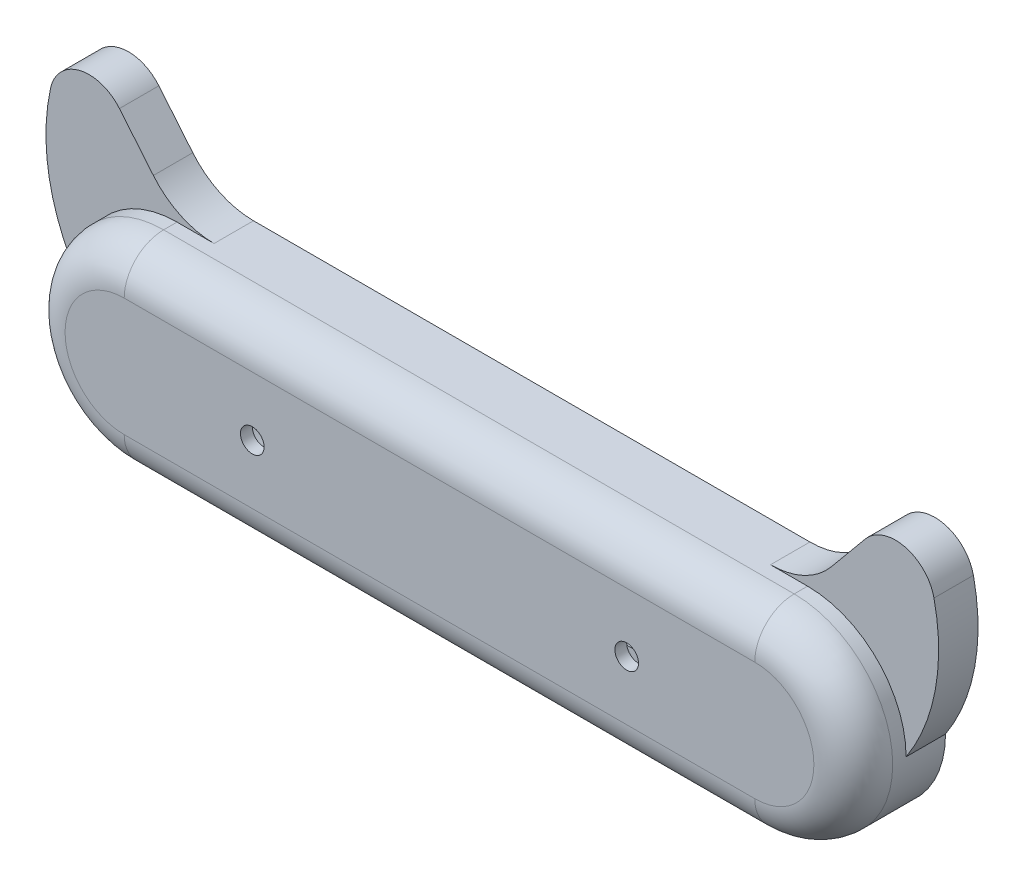
from build123d import *

# Parameters (mm, degrees)
SKETCH1_R           = 2
BOSS_EXTRUDE1_DEPTH = 4
BOSS_EXTRUDE2_DEPTH = 16.4
SKETCH3_R           = 3
BOSS_EXTRUDE3_DEPTH = 3
FILLET1_R           = 10
BOSS_EXTRUDE4_DEPTH = 10
FILLET3_R           = 10
CUT_EXTRUDE3_DEPTH  = 7.5
SKETCH9_W           = 25
SKETCH9_H           = 14
CUT_EXTRUDE4_DEPTH  = 15
FILLET4_R           = 20
SKETCH10_R          = 2.55
CUT_EXTRUDE5_DEPTH  = 4


with BuildPart() as part:
    # Sketch1 → Boss-Extrude1 (new body)
    with BuildSketch(Plane.XY):
        with BuildLine():
            Line((80, -25), (-80, -25))
            ThreePointArc((-80, -25), (-105, 0), (-80, 25))
            Line((-80, 25), (80, 25))
            ThreePointArc((80, 25), (105, 0), (80, -25))
        make_face()
        with Locations((75, -15)):
            Circle(SKETCH1_R, mode=Mode.SUBTRACT)
        with Locations((75, 15)):
            Circle(SKETCH1_R, mode=Mode.SUBTRACT)
        with Locations((-75, -15)):
            Circle(SKETCH1_R, mode=Mode.SUBTRACT)
        with Locations((-75, 15)):
            Circle(SKETCH1_R, mode=Mode.SUBTRACT)
        with BuildLine():
            Line((47.5, -14.5), (-47.5, -14.5))
            ThreePointArc((-47.5, -14.5), (-62, 0), (-47.5, 14.5))
            Line((-47.5, 14.5), (47.5, 14.5))
            ThreePointArc((47.5, 14.5), (62, 0), (47.5, -14.5))
        make_face(mode=Mode.SUBTRACT)
    extrude(amount=BOSS_EXTRUDE1_DEPTH)

    # Sketch2 → Boss-Extrude2 (add)
    with BuildSketch(Plane.XY.offset(4)):
        with BuildLine():
            Line((80, 25), (-80, 25))
            ThreePointArc((-80, 25), (-105, 0), (-80, -25))
            Line((-80, -25), (80, -25))
            ThreePointArc((80, -25), (105, 0), (80, 25))
        make_face()
        with BuildLine():
            Line((47.5, 14.5), (-47.5, 14.5))
            ThreePointArc((-47.5, 14.5), (-62, 0), (-47.5, -14.5))
            Line((-47.5, -14.5), (47.5, -14.5))
            ThreePointArc((47.5, -14.5), (62, 0), (47.5, 14.5))
        make_face(mode=Mode.SUBTRACT)
    extrude(amount=BOSS_EXTRUDE2_DEPTH)

    # Sketch3 → Boss-Extrude3 (add)
    with BuildSketch(Plane.XY.offset(20.4)):
        with BuildLine():
            Line((80, 25), (-80, 25))
            ThreePointArc((-80, 25), (-105, 0), (-80, -25))
            Line((-80, -25), (80, -25))
            ThreePointArc((80, -25), (105, 0), (80, 25))
        make_face()
        with Locations((-47.5, 0)):
            Circle(SKETCH3_R, mode=Mode.SUBTRACT)
        with Locations((47.5, 0)):
            Circle(SKETCH3_R, mode=Mode.SUBTRACT)
    extrude(amount=BOSS_EXTRUDE3_DEPTH)

    # Fillet1
    fillet1_edges = [part.edges().sort_by_distance(p)[0] for p in [
        (105, 0, 23.4),
        (0, 25, 23.4),
        (-105, 0, 23.4),
        (0, -25, 23.4),
    ]]
    fillet(fillet1_edges, radius=FILLET1_R)

    # Sketch4 → Boss-Extrude4 (add)
    with BuildSketch(Plane(origin=(0, 0, 0), x_dir=(-1, 0, 0), z_dir=(0, 0, -1))):
        with BuildLine():
            Line((80, 25), (105, 55.206564225))
            ThreePointArc((105, 55.206564225), (113.254710442, 27.603282112), (105, 0))
            ThreePointArc((105, 0), (97.67766953, 17.67766953), (80, 25))
        make_face()
        with BuildLine():
            Line((-80, 25), (-105, 55.206564225))
            ThreePointArc((-105, 55.206564225), (-113.254710442, 27.603282112), (-105, 0))
            ThreePointArc((-105, 0), (-97.67766953, 17.67766953), (-80, 25))
        make_face()
    extrude(amount=-BOSS_EXTRUDE4_DEPTH)

    # Fillet3
    fillet3_edges = [part.edges().sort_by_distance(p)[0] for p in [
        (105, 55.206564225, 5),
        (-105, 55.206564225, 5),
    ]]
    fillet(fillet3_edges, radius=FILLET3_R)

    # Sketch8 → Cut-Extrude3 (cut)
    with BuildSketch(Plane(origin=(0, 0, 0), x_dir=(-1, 0, 0), z_dir=(0, 0, -1))):
        with BuildLine():
            Line((-100.820886267, 2.744996978), (-83.851879902, 21.812050625))
            Line((-83.851879902, 21.812050625), (-98.458728042, 39.460958483))
            ThreePointArc((-98.458728042, 39.460958483), (-103.485584806, 41.132991554), (-107.19341332, 37.349211536))
            ThreePointArc((-107.19341332, 37.349211536), (-107.505926341, 19.402788283), (-100.820886267, 2.744996978))
        make_face()
        with BuildLine():
            Line((83.851879902, 21.812050625), (98.458728042, 39.460958483))
            ThreePointArc((98.458728042, 39.460958483), (103.485584806, 41.132991554), (107.19341332, 37.349211536))
            ThreePointArc((107.19341332, 37.349211536), (107.505926341, 19.402788283), (100.820886267, 2.744996978))
            Line((100.820886267, 2.744996978), (83.851879902, 21.812050625))
        make_face()
    extrude(amount=-CUT_EXTRUDE3_DEPTH, mode=Mode.SUBTRACT)

    # Sketch9 → Cut-Extrude4 (cut)
    with BuildSketch(Plane.XZ.offset(25)):
        with Locations((40, 13.4)):
            Rectangle(SKETCH9_W, SKETCH9_H)
    extrude(amount=-CUT_EXTRUDE4_DEPTH, mode=Mode.SUBTRACT)

    # Fillet4
    # the kernel refuses this fillet: 20 mm, written as the material it adds along each edge
    with BuildSketch(Plane(origin=(80, 25, 10), x_dir=(-1, 0, 0), z_dir=(0, 0, -1)), Plane(origin=(-80, 25, 10), x_dir=(-0.6375898750759507, 0.7703759804151696, 0), z_dir=(0, 0, -1))) as fillet4_piece_1:
        with BuildLine():
            CenterArc((FILLET4_R * 0.470432794035, FILLET4_R), FILLET4_R, 219.612336421, 50.387663579)
            Line((-FILLET4_R * 0.29994318638, FILLET4_R * 0.362410124924), (0, 0))
            Line((0, 0), (FILLET4_R * 0.470432794035, 0))
        make_face()
    extrude(amount=10)

    # Sketch10 → Cut-Extrude5 (cut)
    with BuildSketch(Plane.XZ.offset(25)):
        with Locations((-5, 6.7)):
            Circle(SKETCH10_R)
        with Locations(Location((5, 6.7, 0), (0, 0, 180))):
            Circle(SKETCH10_R)
    extrude(amount=-CUT_EXTRUDE5_DEPTH, mode=Mode.SUBTRACT)


solid = part.part
